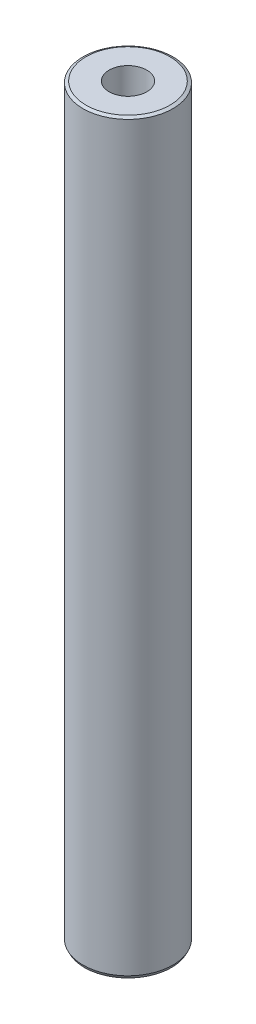
from build123d import *
from OCP.BRepFilletAPI import BRepFilletAPI_MakeChamfer

# Parameters (mm, degrees)
SKETCH1_R           = 22.5
BOSS_EXTRUDE1_DEPTH = 373.454823289
SKETCH2_R           = 9.431710228
CUT_EXTRUDE1_DEPTH  = 375.807957543
CHAMFER1_SIZE       = 0.762097257
CHAMFER1_SIZE2      = 1.491171776


with BuildPart() as part:
    # Sketch1 → Boss-Extrude1 (new body)
    with BuildSketch(Plane(origin=(0, 0, 0), x_dir=(1, 0, 0), z_dir=(0, 1, 0))):
        Circle(SKETCH1_R)
    extrude(amount=BOSS_EXTRUDE1_DEPTH)

    # Sketch2 → Cut-Extrude1 (cut, through all)
    with BuildSketch(Plane(origin=(0, 0, 0), x_dir=(1, 0, 0), z_dir=(0, 1, 0))):
        Circle(SKETCH2_R)
    extrude(amount=CUT_EXTRUDE1_DEPTH, mode=Mode.SUBTRACT)

    # Chamfer1: one chamfer whose edges measure the first distance from different faces: ONE call of the kernel's chamfer builder (chamfer() names one face for all edges)
    chamfer1_edges_1 = [part.edges().sort_by_distance(p)[0] for p in [
        (-22.5, 373.454823289, 0),
    ]]
    chamfer1_side_1 = [part.faces().sort_by_distance(p)[0] for p in [
        (-22.5, 186.727411644, 0),
    ]]
    chamfer1_edges_2 = [part.edges().sort_by_distance(p)[0] for p in [
        (-22.5, 0, 0),
    ]]
    chamfer1_side_2 = [part.faces().sort_by_distance(p)[0] for p in [
        (-21.863603897, 0, 0),
    ]]
    chamfer1 = BRepFilletAPI_MakeChamfer(part.part.solid().wrapped)
    for e in chamfer1_edges_1:
        chamfer1.Add(CHAMFER1_SIZE, CHAMFER1_SIZE2, e.wrapped, chamfer1_side_1[0].wrapped)  # the first distance lies on this face
    for e in chamfer1_edges_2:
        chamfer1.Add(CHAMFER1_SIZE, CHAMFER1_SIZE2, e.wrapped, chamfer1_side_2[0].wrapped)  # the first distance lies on this face
    add(Compound.cast(chamfer1.Shape()), mode=Mode.REPLACE)


solid = part.part
